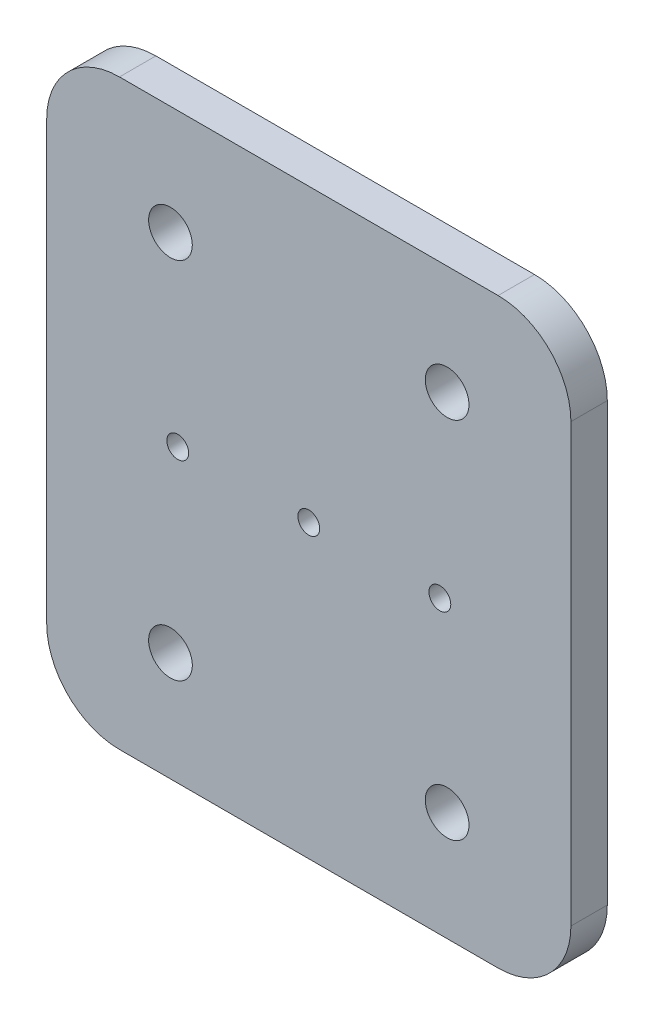
from build123d import *

# Parameters (mm, degrees)
SKETCH1_W           = 72
SKETCH1_H           = 80
SKETCH1_R           = 3
SKETCH1_R_2         = 1.5
BOSS_EXTRUDE1_DEPTH = 5
FILLET1_R           = 10


with BuildPart() as part:
    # Sketch1 → Boss-Extrude1 (new body)
    with BuildSketch(Plane.XY):
        Rectangle(SKETCH1_W, SKETCH1_H)
        with Locations((-19, 25)):
            Circle(SKETCH1_R, mode=Mode.SUBTRACT)
        with Locations((19, 25)):
            Circle(SKETCH1_R, mode=Mode.SUBTRACT)
        with Locations((19, -25)):
            Circle(SKETCH1_R, mode=Mode.SUBTRACT)
        with Locations((-19, -25)):
            Circle(SKETCH1_R, mode=Mode.SUBTRACT)
        Circle(SKETCH1_R_2, mode=Mode.SUBTRACT)
        with Locations((-18, 0)):
            Circle(SKETCH1_R_2, mode=Mode.SUBTRACT)
        with Locations((18, 0)):
            Circle(SKETCH1_R_2, mode=Mode.SUBTRACT)
    extrude(amount=BOSS_EXTRUDE1_DEPTH)

    # Fillet1
    fillet1_edges = [part.edges().sort_by_distance(p)[0] for p in [
        (36, -40, 2.5),
        (-36, -40, 2.5),
        (-36, 40, 2.5),
        (36, 40, 2.5),
    ]]
    fillet(fillet1_edges, radius=FILLET1_R)


solid = part.part
